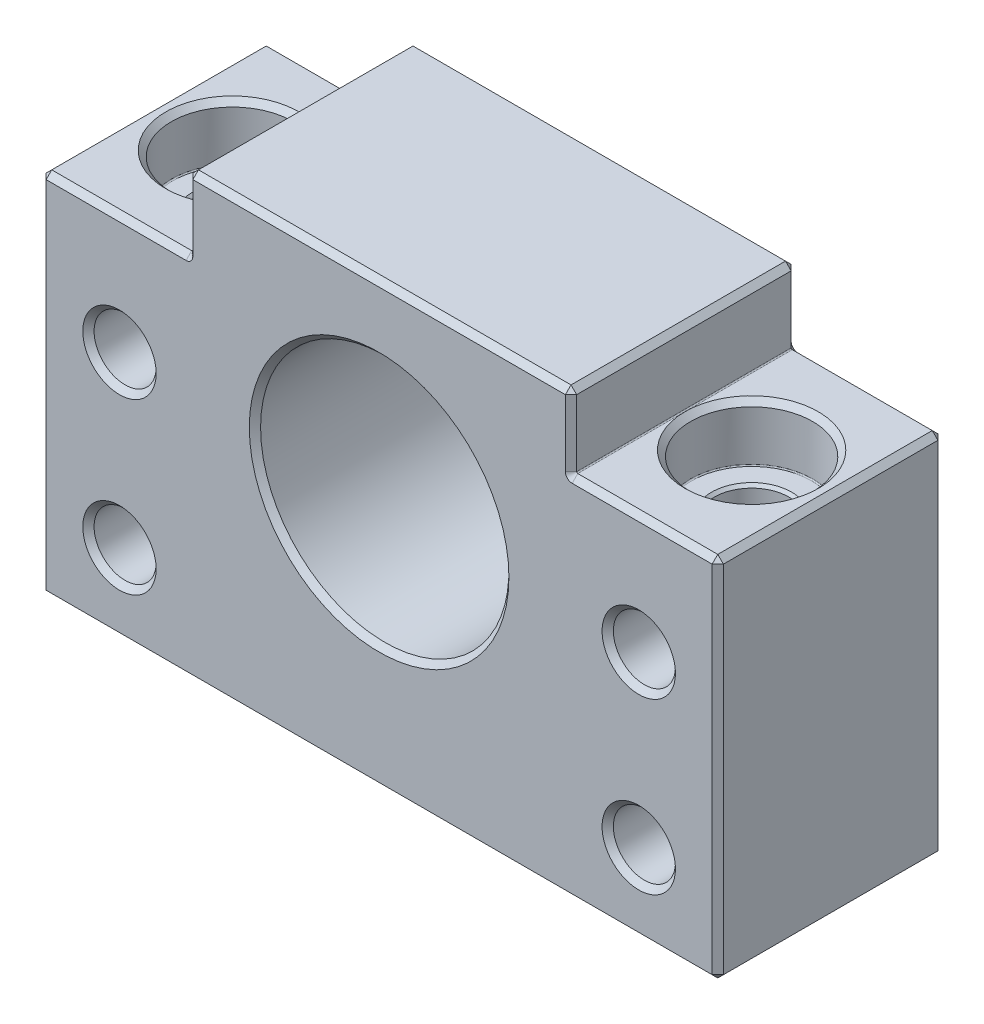
from build123d import *

# Parameters (mm, degrees)
BF_BODY_DEPTH                = 10
BALL_BEARING_HOLE_DEPTH      = 39.522720569
BALL_BEARING_HOLE_DEPTH_BACK = 39.522720569
BALL_BEARING_HOLE_SKETCH_R   = 11
VERTICAL_HOLES_AT_2_COUNT    = 2
VERTICAL_HOLES_AT_2_PITCH    = 46
HORIZONTAL_HOLES_AT_2_COUNT  = 2
HORIZONTAL_HOLES_AT_2_PITCH  = 46
HORIZONTAL_HOLES_AT_3_COUNT  = 2
HORIZONTAL_HOLES_AT_3_PITCH  = 48.383881614
HORIZONTAL_HOLES_AT_4_COUNT  = 2
HORIZONTAL_HOLES_AT_4_PITCH  = 15
PRODUCTION_FILET_R           = 0.1
AESTHETIC_CHAMFER_SIZE       = 0.5


with BuildPart() as part:
    # BF Body Sketch → BF Body (new, symmetric)
    with BuildSketch(Plane.XY):
        Polygon((30, -22), (-30, -22), (-30, 10.5), (-17, 10.5), (-17, 17), (17, 17), (17, 10.5), (30, 10.5), align=None)
    extrude(amount=BF_BODY_DEPTH, both=True)

    # Ball Bearing Hole Sketch → Ball Bearing Hole (cut, two sides: drawn at the far end of the back side and taken through both)
    with BuildSketch(Plane.XY.offset(-BALL_BEARING_HOLE_DEPTH_BACK)):
        Circle(BALL_BEARING_HOLE_SKETCH_R)
    extrude(amount=BALL_BEARING_HOLE_DEPTH + BALL_BEARING_HOLE_DEPTH_BACK, mode=Mode.SUBTRACT)

    # Sketch2 → Vertical Holes (revolve, cut)
    with BuildSketch(Plane(origin=(-23, 10.5, 0), x_dir=(0, 0, 1), z_dir=(1, 0, 0))):
        Polygon((0, 0), (0, 32.5), (3.8, 32.5), (3.3, 32), (3.3, 5.25), (3.55, 5), (5.4, 5), (5.4, 0.5), (5.9, 0), align=None)
    vertical_holes = revolve(axis=Axis((-23, 16.85, 0), (0, -1, 0)), mode=Mode.SUBTRACT)

    # Vertical Holes at 2: Vertical Holes ×2
    with Locations(*[(i * VERTICAL_HOLES_AT_2_PITCH, 0, 0) for i in range(1, VERTICAL_HOLES_AT_2_COUNT)]):
        add(vertical_holes, mode=Mode.SUBTRACT)

    # Sketch4 → Horizontal Holes (revolve, cut)
    with BuildSketch(Plane(origin=(-23, 0, 10), x_dir=(0, -1, 0), z_dir=(1, 0, 0))):
        Polygon((0, 0), (0, 20), (3.25, 20), (2.75, 19.5), (2.75, 0.5), (3.25, 0), align=None)
    horizontal_holes = revolve(axis=Axis((-23, 0, 16.35), (0, 0, -1)), mode=Mode.SUBTRACT)

    # Horizontal Holes at 2: Horizontal Holes ×2
    with Locations(*[(i * HORIZONTAL_HOLES_AT_2_PITCH, 0, 0) for i in range(1, HORIZONTAL_HOLES_AT_2_COUNT)]):
        add(horizontal_holes, mode=Mode.SUBTRACT)

    # Horizontal Holes at 3: Horizontal Holes ×2
    with Locations(*[Vector(0.9507298394814789, -0.31002059983091673, 0) * (i * HORIZONTAL_HOLES_AT_3_PITCH) for i in range(1, HORIZONTAL_HOLES_AT_3_COUNT)]):
        add(horizontal_holes, mode=Mode.SUBTRACT)

    # Horizontal Holes at 4: Horizontal Holes ×2
    with Locations(*[(0, -i * HORIZONTAL_HOLES_AT_4_PITCH, 0) for i in range(1, HORIZONTAL_HOLES_AT_4_COUNT)]):
        add(horizontal_holes, mode=Mode.SUBTRACT)

    # Production Filet
    production_filet_edges = [part.edges().sort_by_distance(p)[0] for p in [
        (-17, 10.5, 0),
        (17, 10.5, 0),
        (23, 5.5, -5.4),
        (-23, 5.5, -5.4),
    ]]
    fillet(production_filet_edges, radius=PRODUCTION_FILET_R - 0.0001)  # a hair under: the kernel refuses the full size

    # Aesthetic Chamfer
    aesthetic_chamfer_edges = [part.edges().sort_by_distance(p)[0] for p in [
        (-23.54995, 10.5, -10),
        (-23.54995, 10.5, 10),
        (23.54995, 10.5, -10),
        (17, 13.79995, -10),
        (17, 13.79995, 10),
        (30, -5.75, -10),
        (-17.029260033, 10.529260033, -10),
        (-17.029260033, 10.529260033, 10),
        (17.029260033, 10.529260033, -10),
        (17.029260033, 10.529260033, 10),
        (0, 17, 10),
        (30, -22, 0),
        (-30, -22, 0),
        (-30, 10.5, 0),
        (-17, 17, 0),
        (17, 17, 0),
        (30, 10.5, 0),
        (-17, 13.79995, 10),
        (-30, -5.75, 10),
        (-11, 0, -10),
        (-11, 0, 10),
        (0, -22, 10),
        (30, -5.75, 10),
        (23.54995, 10.5, 10),
        (0, -22, -10),
        (-30, -5.75, -10),
        (-17, 13.79995, -10),
        (0, 17, -10),
    ]]
    chamfer(aesthetic_chamfer_edges, length=AESTHETIC_CHAMFER_SIZE)


solid = part.part
